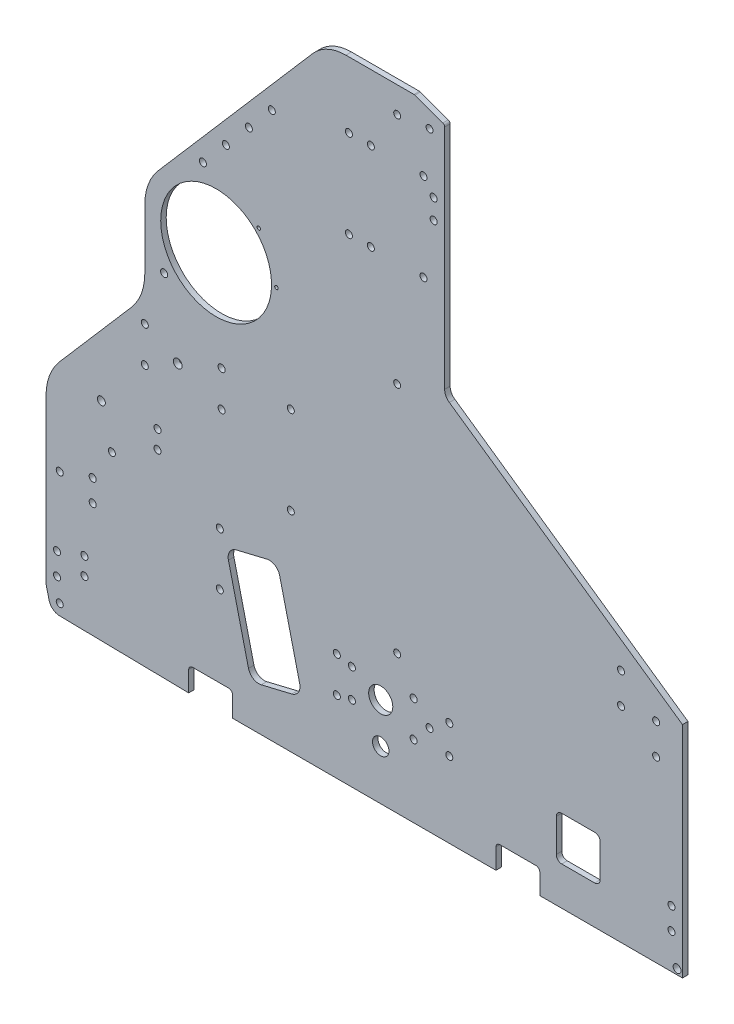
from build123d import *

# Parameters (mm, degrees)
SKETCH1_R           = 2.032
SKETCH1_R_2         = 2.54
SKETCH1_R_3         = 2
BOSS_EXTRUDE1_DEPTH = 3.175
FILLET1_R           = 2.286
FILLET2_R           = 6.35
SKETCH2_R           = 2.032
CUT_EXTRUDE1_DEPTH  = 505.524983177
FILLET3_R           = 1.5875
SKETCH3_R           = 2.032
SKETCH3_R_2         = 2.286
SKETCH3_R_3         = 1.016
CUT_EXTRUDE2_DEPTH  = 505.524983177
SKETCH4_R           = 2.032
SKETCH4_R_2         = 6.985
SKETCH4_R_3         = 4.7625
CUT_EXTRUDE3_DEPTH  = 505.524983177
SKETCH5_R           = 32.0675
SKETCH5_R_2         = 2.286000001
CUT_EXTRUDE5_DEPTH  = 505.524983177
FILLET4_R           = 31.75
CUT_EXTRUDE6_DEPTH  = 505.524983177
FILLET5_R           = 25.4
SKETCH8_R           = 2.032
CUT_EXTRUDE7_DEPTH  = 505.524983177
SKETCH10_R          = 2.032
CUT_EXTRUDE8_DEPTH  = 505.524983177


with BuildPart() as part:
    # Sketch1 → Boss-Extrude1 (new body)
    with BuildSketch(Plane.XY):
        with BuildLine():
            Line((7.829508682, -19.049081656), (82.55, -20.32))
            Line((82.55, -20.32), (82.55, -6.35))
            Line((82.55, -6.35), (107.95, -6.35))
            Line((107.95, -6.35), (107.95, -20.32))
            Line((107.95, -20.32), (260.35, -20.32))
            Line((260.35, -20.32), (260.35, -6.35))
            Line((260.35, -6.35), (285.75, -6.35))
            Line((285.75, -6.35), (285.75, -20.32))
            Line((285.75, -20.32), (368.3, -20.32))
            Line((368.3, -20.32), (368.3, 106.68))
            Line((368.3, 106.68), (230.66375, 202.565))
            Line((230.66375, 202.565), (230.66375, 338.455))
            Line((230.66375, 338.455), (213.19998, 344.805))
            Line((213.19998, 344.805), (203.2, 344.805))
            Line((203.2, 344.805), (161.925, 344.805))
            Line((161.925, 344.805), (52.720122664, 218.469945827))
            ThreePointArc((52.720122664, 218.469945827), (52.803835479, 218.142145922), (52.832, 217.805))
            ThreePointArc((52.832, 217.805), (52.095493096, 216.239521914), (50.419872403, 215.808871996))
            Line((50.419872403, 215.808871996), (0, 157.48))
            Line((0, 157.48), (0, 0))
            Line((0, 0), (0, -6.35))
            ThreePointArc((0, -6.35), (0.047577015, -7.125863724), (0.189595124, -7.890101219))
            Line((0.189595124, -7.890101219), (1.777095124, -14.240101219))
            ThreePointArc((1.777095124, -14.240101219), (3.987212552, -17.671692778), (7.829508682, -19.049081656))
        make_face()
        with Locations((7.9375, -12.7)):
            Circle(SKETCH1_R, mode=Mode.SUBTRACT)
        with Locations((6.35, 0)):
            Circle(SKETCH1_R, mode=Mode.SUBTRACT)
        with Locations((6.35, 12.7)):
            Circle(SKETCH1_R, mode=Mode.SUBTRACT)
        with Locations((38.1, 78.105)):
            Circle(SKETCH1_R, mode=Mode.SUBTRACT)
        with Locations((57.15, 131.28625)):
            Circle(SKETCH1_R, mode=Mode.SUBTRACT)
        with Locations((57.15, 151.92375)):
            Circle(SKETCH1_R, mode=Mode.SUBTRACT)
        with Locations((76.2, 141.605)):
            Circle(SKETCH1_R_2, mode=Mode.SUBTRACT)
        with Locations((101.6, 131.28625)):
            Circle(SKETCH1_R, mode=Mode.SUBTRACT)
        with Locations((101.6, 151.92375)):
            Circle(SKETCH1_R, mode=Mode.SUBTRACT)
        with Locations((203.2, 59.805)):
            Circle(SKETCH1_R_3, mode=Mode.SUBTRACT)
        with Locations((361.95, 0)):
            Circle(SKETCH1_R, mode=Mode.SUBTRACT)
        with Locations((361.95, 12.7)):
            Circle(SKETCH1_R, mode=Mode.SUBTRACT)
        with Locations((353.06, 82.955052336)):
            Circle(SKETCH1_R, mode=Mode.SUBTRACT)
        with Locations((332.74, 98.195052336)):
            Circle(SKETCH1_R, mode=Mode.SUBTRACT)
        with Locations((332.74, 115.975052336)):
            Circle(SKETCH1_R, mode=Mode.SUBTRACT)
        with Locations((353.06, 100.735052336)):
            Circle(SKETCH1_R, mode=Mode.SUBTRACT)
        with Locations((68.326, 182.923674932)):
            Circle(SKETCH1_R, mode=Mode.SUBTRACT)
        with Locations((76.2, 217.805)):
            Circle(SKETCH1_R, mode=Mode.SUBTRACT)
        with Locations((90.779500502, 249.682)):
            Circle(SKETCH1_R, mode=Mode.SUBTRACT)
        with Locations((104.067838673, 265.054783374)):
            Circle(SKETCH1_R, mode=Mode.SUBTRACT)
        with Locations((117.356176844, 280.427566748)):
            Circle(SKETCH1_R, mode=Mode.SUBTRACT)
        with Locations((130.644515014, 295.800350122)):
            Circle(SKETCH1_R, mode=Mode.SUBTRACT)
        with Locations((203.2, 194.805)):
            Circle(SKETCH1_R_3, mode=Mode.SUBTRACT)
        with Locations((224.31375, 287.401)):
            Circle(SKETCH1_R, mode=Mode.SUBTRACT)
        with Locations((224.31375, 298.831)):
            Circle(SKETCH1_R, mode=Mode.SUBTRACT)
        with Locations((203.2, 329.805)):
            Circle(SKETCH1_R_3, mode=Mode.SUBTRACT)
        with Locations((221.931865, 332.105)):
            Circle(SKETCH1_R_3, mode=Mode.SUBTRACT)
    extrude(amount=BOSS_EXTRUDE1_DEPTH)

    # Fillet1
    fillet1_edges = [part.edges().sort_by_distance(p)[0] for p in [
        (285.75, -6.35, 1.5875),
        (107.95, -6.35, 1.5875),
        (260.35, -6.35, 1.5875),
        (82.55, -6.35, 1.5875),
    ]]
    fillet(fillet1_edges, radius=FILLET1_R)

    # Fillet2
    fillet2_edges = [part.edges().sort_by_distance(p)[0] for p in [
        (230.66375, 202.565, 1.5875),
    ]]
    fillet(fillet2_edges, radius=FILLET2_R)

    # Sketch2 → Cut-Extrude1 (cut, through all)
    with BuildSketch(Plane(origin=(0, 0, 0), x_dir=(-1, 0, 0), z_dir=(0, 0, -1))):
        with Locations((-100.552770272, 71.086035298)):
            Circle(SKETCH2_R)
        with Locations((-100.552770272, 40.606035298)):
            Circle(SKETCH2_R)
        with Locations((-22.225, 18.202541089)):
            Circle(SKETCH2_R)
        with Locations((-22.225, 8.042541089)):
            Circle(SKETCH2_R)
    extrude(amount=-CUT_EXTRUDE1_DEPTH, mode=Mode.SUBTRACT)

    # Fillet3
    fillet3_edges = [part.edges().sort_by_distance(p)[0] for p in [
        (230.66375, 338.455, 1.5875),
        (213.19998, 344.805, 1.5875),
    ]]
    fillet(fillet3_edges, radius=FILLET3_R)

    # Sketch3 → Cut-Extrude2 (cut, through all)
    with BuildSketch(Plane.XY.offset(3.175)):
        with BuildLine():
            Line((127.789350211, 69.359774106), (110.09075034, 65.117184968))
            ThreePointArc((110.09075034, 65.117184968), (106.287939856, 62.356288953), (105.55119507, 57.715047577))
            Line((105.55119507, 57.715047577), (117.160037875, 9.287010566))
            ThreePointArc((117.160037875, 9.287010566), (119.920933891, 5.484200083), (124.562175266, 4.747455297))
            Line((124.562175266, 4.747455297), (142.260775138, 8.990044434))
            ThreePointArc((142.260775138, 8.990044434), (146.063585622, 11.75094045), (146.800330407, 16.392181825))
            Line((146.800330407, 16.392181825), (135.191487602, 64.820218836))
            ThreePointArc((135.191487602, 64.820218836), (132.430591587, 68.62302932), (127.789350211, 69.359774106))
        make_face()
        with Locations((26.987500002, 46.953113935)):
            Circle(SKETCH3_R)
        with Locations((26.987500002, 59.653113935)):
            Circle(SKETCH3_R)
        with Locations((7.937500002, 53.303113935)):
            Circle(SKETCH3_R)
        with Locations((32.030600738, 100.810868776)):
            Circle(SKETCH3_R_2)
        with Locations((64.525942114, 102.94048958)):
            Circle(SKETCH3_R)
        with Locations((64.525942114, 92.525786339)):
            Circle(SKETCH3_R)
        with Locations((133.35, 208.228121768)):
            Circle(SKETCH3_R_3)
        with Locations((123.120704333, 232.923826101)):
            Circle(SKETCH3_R_3)
    extrude(amount=-CUT_EXTRUDE2_DEPTH, mode=Mode.SUBTRACT)

    # Sketch4 → Cut-Extrude3 (cut, through all)
    with BuildSketch(Plane.XY.offset(3.175)):
        with Locations((168.275, 42.06875)):
            Circle(SKETCH4_R)
        with Locations((212.725, 42.06875)):
            Circle(SKETCH4_R)
        with Locations((212.725, 21.43125)):
            Circle(SKETCH4_R)
        with Locations((168.275, 21.43125)):
            Circle(SKETCH4_R)
        with Locations((193.675, 31.75)):
            Circle(SKETCH4_R_2)
        with Locations((177.00498, 40.0431)):
            Circle(SKETCH4_R)
        with Locations((177.00498, 23.4569)):
            Circle(SKETCH4_R)
        with Locations((193.675, 8.466666658)):
            Circle(SKETCH4_R_3)
        with Locations((221.931865, 31.75)):
            Circle(SKETCH4_R)
        with Locations((233.36123, 23.4569)):
            Circle(SKETCH4_R)
        with Locations((233.36123, 40.0431)):
            Circle(SKETCH4_R)
    extrude(amount=-CUT_EXTRUDE3_DEPTH, mode=Mode.SUBTRACT)

    # Sketch5 → Cut-Extrude5 (cut, through all)
    with BuildSketch(Plane(origin=(0, 0, 0), x_dir=(-1, 0, 0), z_dir=(0, 0, -1))):
        Polygon((0, 157.48), (-57.15, 223.594705882), (-57.15, 165.333696112), (0, 99.218990229), align=None)
        with Locations((-98.425, 208.228121768)):
            Circle(SKETCH5_R)
        with Locations((-365.170790347, -17.190790347)):
            Circle(SKETCH5_R_2)
    extrude(amount=-CUT_EXTRUDE5_DEPTH, mode=Mode.SUBTRACT)

    # Fillet4
    fillet4_edges = [part.edges().sort_by_distance(p)[0] for p in [
        (0, 99.218990229, 1.5875),
        (57.15, 165.333696112, 1.5875),
        (57.15, 223.594705882, 1.5875),
    ]]
    fillet(fillet4_edges, radius=FILLET4_R)

    # Sketch6 → Cut-Extrude6 (cut, through all)
    with BuildSketch(Plane.XY.offset(3.175)):
        with BuildLine():
            Line((298.45, 27.305), (317.5, 27.305))
            ThreePointArc((317.5, 27.305), (319.74506403, 26.37506403), (320.675, 24.13))
            Line((320.675, 24.13), (320.675, 5.08))
            ThreePointArc((320.675, 5.08), (319.74506403, 2.83493597), (317.5, 1.905))
            Line((317.5, 1.905), (298.45, 1.905))
            ThreePointArc((298.45, 1.905), (296.20493597, 2.83493597), (295.275, 5.08))
            Line((295.275, 5.08), (295.275, 24.13))
            ThreePointArc((295.275, 24.13), (296.20493597, 26.37506403), (298.45, 27.305))
        make_face()
    extrude(amount=-CUT_EXTRUDE6_DEPTH, mode=Mode.SUBTRACT)

    # Fillet5
    fillet5_edges = [part.edges().sort_by_distance(p)[0] for p in [
        (161.925, 344.805, 1.5875),
    ]]
    fillet(fillet5_edges, radius=FILLET5_R)

    # Sketch8 → Cut-Extrude7 (cut, through all)
    with BuildSketch(Plane(origin=(0, 0, 0), x_dir=(-1, 0, 0), z_dir=(0, 0, -1))):
        with Locations((-187.96, 306.704999913)):
            Circle(SKETCH8_R)
        with Locations((-175.26, 306.704999913)):
            Circle(SKETCH8_R)
        with Locations((-218.44, 306.704999905)):
            Circle(SKETCH8_R)
        with Locations((-218.44, 255.904999905)):
            Circle(SKETCH8_R)
        with Locations((-187.96, 255.904999913)):
            Circle(SKETCH8_R)
        with Locations((-175.26, 255.904999913)):
            Circle(SKETCH8_R)
    extrude(amount=-CUT_EXTRUDE7_DEPTH, mode=Mode.SUBTRACT)

    # Sketch10 → Cut-Extrude8 (cut, through all)
    with BuildSketch(Plane.XY.offset(3.175)):
        with Locations((141.64248, 151.360621768)):
            Circle(SKETCH10_R)
        with Locations((141.64248, 100.560621768)):
            Circle(SKETCH10_R)
    extrude(amount=-CUT_EXTRUDE8_DEPTH, mode=Mode.SUBTRACT)


solid = part.part
